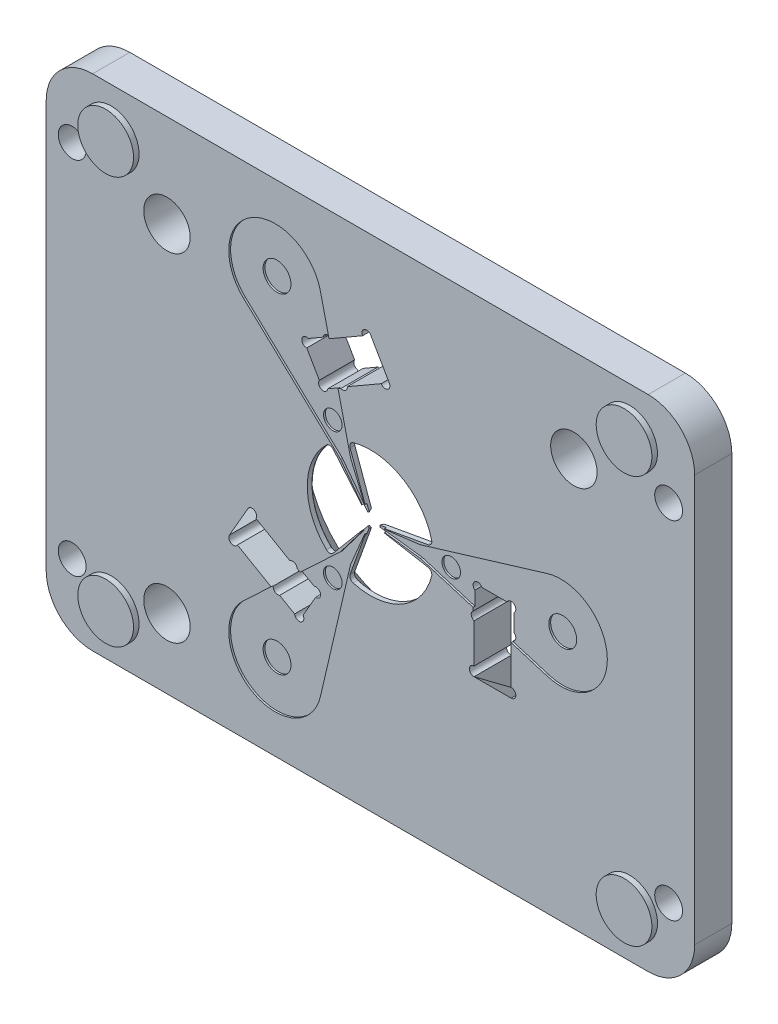
from build123d import *
from build123d.topology import SkipClean

# Parameters (mm, degrees)
SKETCH_1_W           = 76
SKETCH_1_H           = 60
EXTRUDE_1_DEPTH      = 4
CUT_EXTRUDE_1_DEPTH  = 0.5
SKETCH_5_W           = 76
SKETCH_5_H           = 60
CUT_EXTRUDE_4_DEPTH  = 10
CUT_EXTRUDE_5_DEPTH  = 45.244999717
SKETCH_9_R           = 1.5
CUT_EXTRUDE_6_DEPTH  = 45.244999717
CUT_EXTRUDE_8_DEPTH  = 0.5
EXTRUDE_START        = 0.5
EXTRUDE_2_DEPTH      = 0.5
SKETCH_17_R          = 2.5
CUT_EXTRUDE_9_DEPTH  = 45.244999727
SKETCH_18_W          = 4
SKETCH_18_H          = 4.45
CUT_EXTRUDE_10_DEPTH = 0.9
CUT_EXTRUDE_11_DEPTH = 0.2
CUT_EXTRUDE_12_DEPTH = 4
CUT_EXTRUDE_13_DEPTH = 4
CUT_EXTRUDE_14_DEPTH = 4
SKETCH_26_R          = 1.526637958
CUT_EXTRUDE_15_DEPTH = 0.2
SKETCH_27_R          = 1.5
SKETCH_27_R_2        = 1
CUT_EXTRUDE_16_DEPTH = 0.2
SKETCH_29_R          = 3
EXTRUDE_3_DEPTH      = 0.6
CUT_EXTRUDE_17_DEPTH = 45.172729151


with BuildPart() as part:
    # 草圖1 → 填料-伸長1 (new body)
    with BuildSketch(Plane.XY):
        Rectangle(SKETCH_1_W, SKETCH_1_H)
    extrude(amount=EXTRUDE_1_DEPTH)

    # 草圖2 → 除料-伸長1 (cut)
    with BuildSketch(Plane.XY.offset(4)):
        with BuildLine():
            Line((0.357380647, 0.004961492), (4.50941379, 0.523267787))
            ThreePointArc((4.50941379, 0.523267787), (5.349803134, 0.664770922), (6.175092484, 0.877314741))
            Line((6.175092484, 0.877314741), (19.047808057, 4.784468472))
            ThreePointArc((19.047808057, 4.784468472), (25.5, 0), (19.047808057, -4.784468472))
            Line((19.047808057, -4.784468472), (6.175092484, -0.877314741))
            ThreePointArc((6.175092484, -0.877314741), (5.349803134, -0.664770922), (4.50941379, -0.523267787))
            Line((4.50941379, -0.523267787), (0.357380647, -0.004961492))
            ThreePointArc((0.357380647, -0.004961492), (0.353, 0), (0.357380647, 0.004961492))
        make_face()
        with BuildLine():
            Line((-2.327769389, -5.786444332), (-5.380432788, -18.8881199))
            ThreePointArc((-5.380432788, -18.8881199), (-12.75, -22.083647797), (-13.667375269, -14.103651428))
            Line((-13.667375269, -14.103651428), (-3.847323094, -4.909129591))
            ThreePointArc((-3.847323094, -4.909129591), (-3.250610073, -4.300679958), (-2.707870091, -3.643633005))
            Line((-2.707870091, -3.643633005), (-0.182987102, -0.307019973))
            ThreePointArc((-0.182987102, -0.307019973), (-0.1765, -0.305706968), (-0.174393546, -0.311981465))
            Line((-0.174393546, -0.311981465), (-1.801543699, -4.166900792))
            ThreePointArc((-1.801543699, -4.166900792), (-2.09919306, -4.96545088), (-2.327769389, -5.786444332))
        make_face()
        with BuildLine():
            Line((-3.847323094, 4.909129591), (-13.667375269, 14.103651428))
            ThreePointArc((-13.667375269, 14.103651428), (-12.75, 22.083647797), (-5.380432788, 18.8881199))
            Line((-5.380432788, 18.8881199), (-2.327769389, 5.786444332))
            ThreePointArc((-2.327769389, 5.786444332), (-2.09919306, 4.96545088), (-1.801543699, 4.166900792))
            Line((-1.801543699, 4.166900792), (-0.174393546, 0.311981465))
            ThreePointArc((-0.174393546, 0.311981465), (-0.1765, 0.305706968), (-0.182987102, 0.307019973))
            Line((-0.182987102, 0.307019973), (-2.707870091, 3.643633005))
            ThreePointArc((-2.707870091, 3.643633005), (-3.250610073, 4.300679958), (-3.847323094, 4.909129591))
        make_face()
    extrude(amount=-CUT_EXTRUDE_1_DEPTH, mode=Mode.SUBTRACT)

    # 草圖5 → 除料-伸長4 (cut)
    with BuildSketch(Plane.XY.offset(4)):
        Rectangle(SKETCH_5_W, SKETCH_5_H)
        with BuildLine():
            ThreePointArc((-34.9, 21.9), (-33.435533906, 25.435533906), (-29.9, 26.9))
            Line((-29.9, 26.9), (29.9, 26.9))
            ThreePointArc((29.9, 26.9), (33.435533906, 25.435533906), (34.9, 21.9))
            Line((34.9, 21.9), (34.9, -21.9))
            ThreePointArc((34.9, -21.9), (33.435533906, -25.435533906), (29.9, -26.9))
            Line((29.9, -26.9), (-29.9, -26.9))
            ThreePointArc((-29.9, -26.9), (-33.435533906, -25.435533906), (-34.9, -21.9))
            Line((-34.9, -21.9), (-34.9, 21.9))
        make_face(mode=Mode.SUBTRACT)
    extrude(amount=-CUT_EXTRUDE_4_DEPTH, mode=Mode.SUBTRACT)

    # 草圖7 → 除料-伸長5 (cut, through all)
    with BuildSketch(Plane.XY.offset(4)):
        with BuildLine():
            ThreePointArc((11.798296094, -0.228571429), (11.03056096, -0.065346), (11.05, -0.85))
            Line((11.05, -0.85), (11.05, -2.707142857))
            ThreePointArc((11.05, -2.707142857), (11.03056096, -3.491796857), (11.798296094, -3.328571429))
            Line((11.798296094, -3.328571429), (14.501703906, -3.328571429))
            ThreePointArc((14.501703906, -3.328571429), (15.26943904, -3.491796857), (15.25, -2.707142857))
            Line((15.25, -2.707142857), (15.25, -0.85))
            ThreePointArc((15.25, -0.85), (15.26943904, -0.065346), (14.501703906, -0.228571429))
            Line((14.501703906, -0.228571429), (11.798296094, -0.228571429))
        make_face()
        with BuildLine():
            Line((-6.261121593, -9.144580712), (-7.869454486, -8.216009283))
            ThreePointArc((-7.869454486, -8.216009283), (-8.539265263, -7.806847581), (-8.781775462, -8.553338424))
            Line((-8.781775462, -8.553338424), (-10.133479369, -10.894558267))
            ThreePointArc((-10.133479369, -10.894558267), (-10.658704303, -11.477823681), (-9.969454486, -11.853315979))
            Line((-9.969454486, -11.853315979), (-8.361121593, -12.781887408))
            ThreePointArc((-8.361121593, -12.781887408), (-7.691310816, -13.19104911), (-7.448800617, -12.444558267))
            Line((-7.448800617, -12.444558267), (-6.097096711, -10.103338424))
            ThreePointArc((-6.097096711, -10.103338424), (-5.571871776, -9.520073009), (-6.261121593, -9.144580712))
        make_face()
        with BuildLine():
            ThreePointArc((-6.888878407, 13.631887408), (-7.578128224, 13.25639511), (-7.052903289, 12.673129695))
            Line((-7.052903289, 12.673129695), (-5.701199383, 10.331909853))
            ThreePointArc((-5.701199383, 10.331909853), (-5.458689184, 9.585419009), (-4.788878407, 9.994580712))
            Line((-4.788878407, 9.994580712), (-3.180545514, 10.92315214))
            ThreePointArc((-3.180545514, 10.92315214), (-2.491295697, 11.298644438), (-3.016520631, 11.881909853))
            Line((-3.016520631, 11.881909853), (-4.368224538, 14.223129695))
            ThreePointArc((-4.368224538, 14.223129695), (-4.610734737, 14.969620539), (-5.280545514, 14.560458836))
            Line((-5.280545514, 14.560458836), (-6.888878407, 13.631887408))
        make_face()
        with BuildLine():
            Line((15.15, -7.778571429), (11.15, -7.778571429))
            ThreePointArc((11.15, -7.778571429), (10.65, -8.278571429), (11.15, -8.778571429))
            Line((11.15, -8.778571429), (15.15, -8.778571429))
            ThreePointArc((15.15, -8.778571429), (15.65, -8.278571429), (15.15, -7.778571429))
        make_face()
        with BuildLine():
            Line((-14.311440462, -9.230999153), (-12.311440462, -5.766897538))
            ThreePointArc((-12.311440462, -5.766897538), (-12.494453164, -5.083884836), (-13.177465866, -5.266897538))
            Line((-13.177465866, -5.266897538), (-15.177465866, -8.730999153))
            ThreePointArc((-15.177465866, -8.730999153), (-14.994453164, -9.414011855), (-14.311440462, -9.230999153))
        make_face()
        with BuildLine():
            Line((2.027465866, 14.045468966), (0.027465866, 17.509570582))
            ThreePointArc((0.027465866, 17.509570582), (-0.655546836, 17.692583284), (-0.838559538, 17.009570582))
            Line((-0.838559538, 17.009570582), (1.161440462, 13.545468966))
            ThreePointArc((1.161440462, 13.545468966), (1.844453164, 13.362456265), (2.027465866, 14.045468966))
        make_face()
    extrude(amount=-CUT_EXTRUDE_5_DEPTH, mode=Mode.SUBTRACT)

    # 草圖9 → 除料-伸長6 (cut, through all)
    with BuildSketch(Plane.XY.offset(4)):
        with Locations((32.1, 17.9)):
            Circle(SKETCH_9_R)
        with Locations((-32.1, 19.4)):
            Circle(SKETCH_9_R)
        with Locations((-32.1, -19.4)):
            Circle(SKETCH_9_R)
        with Locations((32.1, -19.4)):
            Circle(SKETCH_9_R)
    extrude(amount=-CUT_EXTRUDE_6_DEPTH, mode=Mode.SUBTRACT)

    # 草圖13 → 除料-伸長8 (cut)
    with BuildSketch(Plane.XY.offset(4)):
        with BuildLine():
            Line((0.357380647, 0.004961492), (6.196219764, 1.051194705))
            ThreePointArc((6.196219764, 1.051194705), (6.528171349, 1.272279181), (6.592796173, 1.665844718))
            ThreePointArc((6.592796173, 1.665844718), (3.4, 5.888972746), (-1.853734242, 6.542451327))
            ThreePointArc((-1.853734242, 6.542451327), (-2.162259584, 6.289701819), (-2.187748563, 5.891681076))
            Line((-2.187748563, 5.891681076), (-0.174393546, 0.311981465))
            ThreePointArc((-0.174393546, 0.311981465), (-0.1765, 0.305706968), (-0.182987102, 0.307019973))
            Line((-0.182987102, 0.307019973), (-4.008471201, 4.84048637))
            ThreePointArc((-4.008471201, 4.84048637), (-4.365911766, 5.017422638), (-4.739061931, 4.876606608))
            ThreePointArc((-4.739061931, 4.876606608), (-6.8, 0), (-4.739061931, -4.876606608))
            ThreePointArc((-4.739061931, -4.876606608), (-4.365911766, -5.017422638), (-4.008471201, -4.84048637))
            Line((-4.008471201, -4.84048637), (-0.182987102, -0.307019973))
            ThreePointArc((-0.182987102, -0.307019973), (-0.1765, -0.305706968), (-0.174393546, -0.311981465))
            Line((-0.174393546, -0.311981465), (-2.187748563, -5.891681076))
            ThreePointArc((-2.187748563, -5.891681076), (-2.162259584, -6.289701819), (-1.853734242, -6.542451327))
            ThreePointArc((-1.853734242, -6.542451327), (3.4, -5.888972746), (6.592796173, -1.665844718))
            ThreePointArc((6.592796173, -1.665844718), (6.528171349, -1.272279181), (6.196219764, -1.051194705))
            Line((6.196219764, -1.051194705), (0.357380647, -0.004961492))
            ThreePointArc((0.357380647, -0.004961492), (0.353, 0), (0.357380647, 0.004961492))
        make_face()
    extrude(amount=-CUT_EXTRUDE_8_DEPTH, mode=Mode.SUBTRACT)

    # 草圖12 → 填料-伸長2 (add)
    with SkipClean():  # the faces are left unmerged after this step: merging them gives an invalid solid
        with BuildSketch(Plane.XY.offset(3.5).offset(EXTRUDE_START)):
            with BuildLine():
                Line((11.05, -2.356956933), (11.05, -0.85))
                ThreePointArc((11.05, -0.85), (11.03056096, -0.065346), (11.798296094, -0.228571429))
                Line((11.798296094, -0.228571429), (14.501703906, -0.228571429))
                ThreePointArc((14.501703906, -0.228571429), (15.26943904, -0.065346), (15.25, -0.85))
                Line((15.25, -0.85), (15.25, -2.707142857))
                ThreePointArc((15.25, -2.707142857), (15.442536346, -3.193212295), (15.09656548, -3.585179007))
                Line((15.09656548, -3.585179007), (19.047808057, -4.784468472))
                ThreePointArc((19.047808057, -4.784468472), (25.5, 0), (19.047808057, 4.784468472))
                Line((19.047808057, 4.784468472), (6.175092484, 0.877314741))
                ThreePointArc((6.175092484, 0.877314741), (5.349803134, 0.664770922), (4.50941379, 0.523267787))
                Line((4.50941379, 0.523267787), (0.357380647, 0.004961492))
                ThreePointArc((0.357380647, 0.004961492), (0.353, 0), (0.357380647, -0.004961492))
                Line((0.357380647, -0.004961492), (4.50941379, -0.523267787))
                ThreePointArc((4.50941379, -0.523267787), (5.349803134, -0.664770922), (6.175092484, -0.877314741))
                Line((6.175092484, -0.877314741), (11.05, -2.356956933))
            make_face()
            with BuildLine():
                Line((-10.653138837, -11.281419712), (-13.667375269, -14.103651428))
                ThreePointArc((-13.667375269, -14.103651428), (-12.75, -22.083647797), (-5.380432788, -18.8881199))
                Line((-5.380432788, -18.8881199), (-2.327769389, -5.786444332))
                ThreePointArc((-2.327769389, -5.786444332), (-2.09919306, -4.96545088), (-1.801543699, -4.166900792))
                Line((-1.801543699, -4.166900792), (-0.174393546, -0.311981465))
                ThreePointArc((-0.174393546, -0.311981465), (-0.1765, -0.305706968), (-0.182987102, -0.307019973))
                Line((-0.182987102, -0.307019973), (-2.707870091, -3.643633005))
                ThreePointArc((-2.707870091, -3.643633005), (-3.250610073, -4.300679958), (-3.847323094, -4.909129591))
                Line((-3.847323094, -4.909129591), (-7.56618458, -8.391102245))
                Line((-7.56618458, -8.391102245), (-6.261121593, -9.144580712))
                ThreePointArc((-6.261121593, -9.144580712), (-5.571871776, -9.520073009), (-6.097096711, -10.103338424))
                Line((-6.097096711, -10.103338424), (-7.448800617, -12.444558267))
                ThreePointArc((-7.448800617, -12.444558267), (-7.691310816, -13.19104911), (-8.361121593, -12.781887408))
                Line((-8.361121593, -12.781887408), (-9.969454486, -11.853315979))
                ThreePointArc((-9.969454486, -11.853315979), (-10.48667114, -11.777022627), (-10.653138837, -11.281419712))
            make_face()
            with BuildLine():
                Line((-3.48381542, 10.748059178), (-4.788878407, 9.994580712))
                ThreePointArc((-4.788878407, 9.994580712), (-5.458689184, 9.585419009), (-5.701199383, 10.331909853))
                Line((-5.701199383, 10.331909853), (-7.052903289, 12.673129695))
                ThreePointArc((-7.052903289, 12.673129695), (-7.578128224, 13.25639511), (-6.888878407, 13.631887408))
                Line((-6.888878407, 13.631887408), (-5.280545514, 14.560458836))
                ThreePointArc((-5.280545514, 14.560458836), (-4.955865206, 14.970234922), (-4.443426643, 14.866598719))
                Line((-4.443426643, 14.866598719), (-5.380432788, 18.8881199))
                ThreePointArc((-5.380432788, 18.8881199), (-12.75, 22.083647797), (-13.667375269, 14.103651428))
                Line((-13.667375269, 14.103651428), (-3.847323094, 4.909129591))
                ThreePointArc((-3.847323094, 4.909129591), (-3.250610073, 4.300679958), (-2.707870091, 3.643633005))
                Line((-2.707870091, 3.643633005), (-0.182987102, 0.307019973))
                ThreePointArc((-0.182987102, 0.307019973), (-0.1765, 0.305706968), (-0.174393546, 0.311981465))
                Line((-0.174393546, 0.311981465), (-1.801543699, 4.166900792))
                ThreePointArc((-1.801543699, 4.166900792), (-2.09919306, 4.96545088), (-2.327769389, 5.786444332))
                Line((-2.327769389, 5.786444332), (-3.48381542, 10.748059178))
            make_face()
        extrude(amount=-EXTRUDE_2_DEPTH)

    # 草圖15 → 除料-旋轉2 (revolve, cut)
    with SkipClean():  # the faces are left unmerged after this step: merging them gives an invalid solid
        with BuildSketch(Plane(origin=(0, 0, 0), x_dir=(1, 0, 0), z_dir=(0, 1, 0))):
            Polygon((11.027465866, 0), (0.027465866, 0), (0.027465866, -3.5), (6.827465866, -3.5), align=None)
        revolve(axis=Axis((0.027465866, 0, 0), (0, 0, 1)), mode=Mode.SUBTRACT)

    # 草圖16 → 除料-旋轉3 (revolve, cut)
    with SkipClean():  # the faces are left unmerged after this step: merging them gives an invalid solid
        with BuildSketch(Plane(origin=(0, 0, 0), x_dir=(1, 0, 0), z_dir=(0, 1, 0))):
            Polygon((0.353, -4.18), (0.353, -3.5), (0.745598183, -3.5), align=None)
        revolve(axis=Axis((0, 0, 0), (0, 0, 1)), mode=Mode.SUBTRACT)

    # 草圖17 → 除料-伸長9 (cut, through all)
    with SkipClean():  # the faces are left unmerged after this step: merging them gives an invalid solid
        with BuildSketch(Plane.XY.offset(4)):
            with Locations((-21.9, 16.9)):
                Circle(SKETCH_17_R)
            with Locations((21.9, 16.9)):
                Circle(SKETCH_17_R)
            with Locations((-21.9, -19.4)):
                Circle(SKETCH_17_R)
        extrude(amount=-CUT_EXTRUDE_9_DEPTH, mode=Mode.SUBTRACT)

    # 草圖18 → 除料-伸長10 (cut)
    with SkipClean():  # the faces are left unmerged after this step: merging them gives an invalid solid
        with BuildSketch(Plane.XY.offset(4)):
            with Locations((13.15, -5.553571429)):
                Rectangle(SKETCH_18_W, SKETCH_18_H)
            Polygon((-0.838559538, 17.009570582), (1.161440462, 13.545468966), (-2.692372585, 11.320468966), (-4.692372585, 14.784570582), align=None)
            Polygon((-10.457627415, -11.455999153), (-8.457627415, -7.991897538), (-12.311440462, -5.766897538), (-14.311440462, -9.230999153), align=None)
        extrude(amount=-CUT_EXTRUDE_10_DEPTH, mode=Mode.SUBTRACT)

    # 草圖20 → 除料-伸長11 (cut)
    with SkipClean():  # the faces are left unmerged after this step: merging them gives an invalid solid
        with BuildSketch(Plane.XY.offset(4)):
            with BuildLine():
                Line((0.357380647, 0.004961492), (5.358, 0.629198438))
                Line((5.358, 0.629198438), (19.047772641, 4.784457722))
                ThreePointArc((19.047772641, 4.784457722), (25.5, 0), (19.047772641, -4.784457722))
                Line((19.047772641, -4.784457722), (5.358, -0.629198438))
                Line((5.358, -0.629198438), (0.357380647, -0.004961492))
                ThreePointArc((0.357380647, -0.004961492), (0.353, 0), (0.357380647, 0.004961492))
            make_face()
            with BuildLine():
                Line((-0.182987102, -0.307019973), (-3.223901831, -4.325564895))
                Line((-3.223901831, -4.325564895), (-13.667348251, -14.103626131))
                ThreePointArc((-13.667348251, -14.103626131), (-12.75, -22.083647797), (-5.380424389, -18.888083853))
                Line((-5.380424389, -18.888083853), (-2.134098169, -4.954763332))
                Line((-2.134098169, -4.954763332), (-0.174393546, -0.311981465))
                ThreePointArc((-0.174393546, -0.311981465), (-0.1765, -0.305706968), (-0.182987102, -0.307019973))
            make_face()
            with BuildLine():
                Line((-0.174393546, 0.311981465), (-2.134098169, 4.954763332))
                Line((-2.134098169, 4.954763332), (-5.380424389, 18.888083853))
                ThreePointArc((-5.380424389, 18.888083853), (-12.75, 22.083647797), (-13.667348251, 14.103626131))
                Line((-13.667348251, 14.103626131), (-3.223901831, 4.325564895))
                Line((-3.223901831, 4.325564895), (-0.182987102, 0.307019973))
                ThreePointArc((-0.182987102, 0.307019973), (-0.1765, 0.305706968), (-0.174393546, 0.311981465))
            make_face()
        extrude(amount=-CUT_EXTRUDE_11_DEPTH, mode=Mode.SUBTRACT)

    # 草圖21 → 除料-旋轉4 (revolve, cut)
    with SkipClean():  # the faces are left unmerged after this step: merging them gives an invalid solid
        with BuildSketch(Plane(origin=(0, 0, 0), x_dir=(1, 0, 0), z_dir=(0, 1, 0))):
            Polygon((0.353, 0), (0.353, -4.25), (0.553, -4.25), (3.006738644, 0), align=None)
        revolve(axis=Axis((0, 0, 0), (0, 0, 1)), mode=Mode.SUBTRACT)

    # 草圖22 → 除料-伸長12 (cut)
    with SkipClean():  # the faces are left unmerged after this step: merging them gives an invalid solid
        with BuildSketch(Plane(origin=(11.15, 0, 0), x_dir=(0, 0, -1), z_dir=(1, 0, 0))):
            Polygon((-4, -8.778571429), (0, -8.778571429), (0, -11.778571429), align=None)
        extrude(amount=CUT_EXTRUDE_12_DEPTH, mode=Mode.SUBTRACT)

    # 草圖23 → 除料-伸長13 (cut)
    with SkipClean():  # the faces are left unmerged after this step: merging them gives an invalid solid
        with BuildSketch(Plane(origin=(-5.575, -9.656183252, 0), x_dir=(-0.8660254037844377, 0.5000000000000019, 0), z_dir=(-0.5000000000000019, -0.8660254037844377, 0))):
            Polygon((8.778571429, -4), (8.778571429, 0), (11.778571429, 0), align=None)
        extrude(amount=CUT_EXTRUDE_13_DEPTH, mode=Mode.SUBTRACT)

    # 草圖24 → 除料-伸長14 (cut)
    with SkipClean():  # the faces are left unmerged after this step: merging them gives an invalid solid
        with BuildSketch(Plane(origin=(-7.575, 13.120284867, 0), x_dir=(-0.8660254037844387, -0.4999999999999999, 0), z_dir=(0.49999999999999994, -0.8660254037844388, 0))):
            Polygon((-8.778571429, -4), (-8.778571429, 0), (-11.778571429, 0), align=None)
        extrude(amount=CUT_EXTRUDE_14_DEPTH, mode=Mode.SUBTRACT)

    # 草圖26 → 除料-伸長15 (cut)
    with SkipClean():  # the faces are left unmerged after this step: merging them gives an invalid solid
        with BuildSketch(Plane.XY.offset(4)):
            Circle(SKETCH_26_R)
        extrude(amount=-CUT_EXTRUDE_15_DEPTH, mode=Mode.SUBTRACT)

    # 草圖27 → 除料-伸長16 (cut)
    with SkipClean():  # the faces are left unmerged after this step: merging them gives an invalid solid
        with BuildSketch(Plane.XY.offset(3.8)):
            with Locations((20.5, 0)):
                Circle(SKETCH_27_R)
            with Locations((8.5, 0)):
                Circle(SKETCH_27_R_2)
            with Locations((-4.25, -7.361215932)):
                Circle(SKETCH_27_R_2)
            with Locations((-10.25, -17.753520778)):
                Circle(SKETCH_27_R)
            with Locations((-4.25, 7.361215932)):
                Circle(SKETCH_27_R_2)
            with Locations((-10.25, 17.753520778)):
                Circle(SKETCH_27_R)
        extrude(amount=-CUT_EXTRUDE_16_DEPTH, mode=Mode.SUBTRACT)

    # 草圖29 → 填料-伸長3 (add)
    with SkipClean():  # the faces are left unmerged after this step: merging them gives an invalid solid
        with BuildSketch(Plane.XY.offset(4)):
            with Locations((-27.9, 21.9)):
                Circle(SKETCH_29_R)
            with Locations((27.9, 21.9)):
                Circle(SKETCH_29_R)
            with Locations((27.9, -21.9)):
                Circle(SKETCH_29_R)
            with Locations((-27.9, -21.9)):
                Circle(SKETCH_29_R)
        extrude(amount=EXTRUDE_3_DEPTH)

    # 草圖30 → 除料-伸長17 (cut, through all)
    with SkipClean():  # the faces are left unmerged after this step: merging them gives an invalid solid
        with BuildSketch(Plane.XY.offset(3.1)):
            with BuildLine():
                Line((-4.368224538, 14.223129695), (-3.016520631, 11.881909853))
                ThreePointArc((-3.016520631, 11.881909853), (-2.663194684, 11.766361753), (-2.487272656, 11.438883466))
                Line((-2.487272656, 11.438883466), (1.161440462, 13.545468966))
                Line((1.161440462, 13.545468966), (-0.838559538, 17.009570582))
                Line((-0.838559538, 17.009570582), (-4.487272656, 14.902985081))
                ThreePointArc((-4.487272656, 14.902985081), (-4.291629154, 14.586892992), (-4.368224538, 14.223129695))
            make_face()
            with BuildLine():
                Line((-10.133479369, -10.894558267), (-8.781775462, -8.553338424))
                ThreePointArc((-8.781775462, -8.553338424), (-8.858370846, -8.189575128), (-8.662727344, -7.873483039))
                Line((-8.662727344, -7.873483039), (-12.311440462, -5.766897538))
                Line((-12.311440462, -5.766897538), (-14.311440462, -9.230999153))
                Line((-14.311440462, -9.230999153), (-10.662727344, -11.337584654))
                ThreePointArc((-10.662727344, -11.337584654), (-10.486805316, -11.010106366), (-10.133479369, -10.894558267))
            make_face()
            with BuildLine():
                Line((14.501703906, -3.328571429), (11.798296094, -3.328571429))
                ThreePointArc((11.798296094, -3.328571429), (11.52156553, -3.576786625), (11.15, -3.565400427))
                Line((11.15, -3.565400427), (11.15, -7.778571429))
                Line((11.15, -7.778571429), (15.15, -7.778571429))
                Line((15.15, -7.778571429), (15.15, -3.565400427))
                ThreePointArc((15.15, -3.565400427), (14.77843447, -3.576786625), (14.501703906, -3.328571429))
            make_face()
        extrude(amount=-CUT_EXTRUDE_17_DEPTH, mode=Mode.SUBTRACT)


solid = part.part
